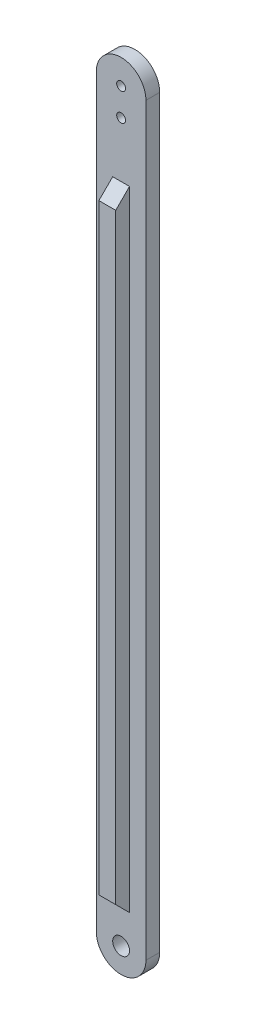
from build123d import *

# Parameters (mm, degrees)
SKETCH1_R           = 3.05
BOSS_EXTRUDE1_DEPTH = 5
SKETCH2_R           = 1.6
CUT_EXTRUDE1_DEPTH  = 10
BOSS_EXTRUDE2_DEPTH = 5
CHAMFER1_SIZE       = 5


with BuildPart() as part:
    # Sketch1 → Boss-Extrude1 (new body)
    with BuildSketch(Plane.XY):
        with BuildLine():
            Line((9, 270), (9, 0))
            ThreePointArc((9, 0), (0, -9), (-9, 0))
            Line((-9, 0), (-9, 270))
            ThreePointArc((-9, 270), (0, 279), (9, 270))
        make_face()
        Circle(SKETCH1_R, mode=Mode.SUBTRACT)
    extrude(amount=BOSS_EXTRUDE1_DEPTH)

    # Sketch2 → Cut-Extrude1 (cut)
    with BuildSketch(Plane.XY.offset(5)):
        with Locations((0, 270)):
            Circle(SKETCH2_R)
        with Locations((0, 260)):
            Circle(SKETCH2_R)
    extrude(amount=-CUT_EXTRUDE1_DEPTH, mode=Mode.SUBTRACT)

    # Sketch3 → Boss-Extrude2 (add)
    with BuildSketch(Plane.XY.offset(5)):
        Polygon((-3.05, 12), (-3.05, 240), (3.05, 240), (3.05, 12), (0, 12), align=None)
    extrude(amount=BOSS_EXTRUDE2_DEPTH)

    # Chamfer1
    chamfer1_edges = [part.edges().sort_by_distance(p)[0] for p in [
        (0, 240, 10),
        (0, 12, 10),
    ]]
    chamfer(chamfer1_edges, length=CHAMFER1_SIZE - 0.0001)  # a hair under: the kernel refuses the full size


solid = part.part
